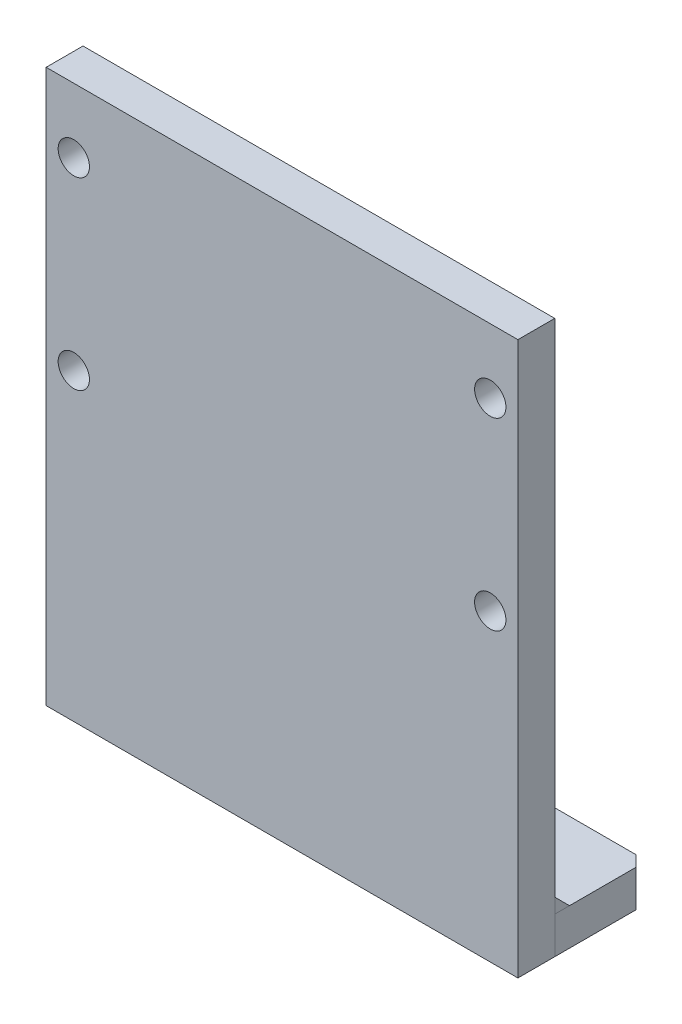
from build123d import *

# Parameters (mm, degrees)
SKETCH1_W           = 128
SKETCH1_H           = 150
SKETCH1_R           = 4.25
BOSS_EXTRUDE1_DEPTH = 5
SKETCH2_W           = 128
SKETCH2_H           = 25
SKETCH2_R           = 4.25
BOSS_EXTRUDE2_DEPTH = 10
FILLET_START        = -64
FILLET_BEAD1_DEPTH  = 128
CHAMFER1_SIZE       = 3


# Read off the part's stored shape, not the designer's step: Fillet Bead1
with BuildPart() as part:
    # Sketch1 → Boss-Extrude1 (new, symmetric)
    with BuildSketch(Plane.XY):
        Rectangle(SKETCH1_W, SKETCH1_H)
        with Locations((-56.5, 57.5)):
            Circle(SKETCH1_R, mode=Mode.SUBTRACT)
        with Locations((-56.5, 7.5)):
            Circle(SKETCH1_R, mode=Mode.SUBTRACT)
        with Locations(Location((56.5, 7.5, 0), (0, 0, 180))):
            Circle(SKETCH1_R, mode=Mode.SUBTRACT)
        with Locations(Location((56.5, 57.5, 0), (0, 0, 180))):
            Circle(SKETCH1_R, mode=Mode.SUBTRACT)
    extrude(amount=BOSS_EXTRUDE1_DEPTH, both=True)


with BuildPart() as body_2:
    # Sketch2 → Boss-Extrude2 (new body)
    with BuildSketch(Plane.XZ.offset(75)):
        with Locations((0, -17.5)):
            Rectangle(SKETCH2_W, SKETCH2_H)
        with Locations((-40, -20)):
            Circle(SKETCH2_R, mode=Mode.SUBTRACT)
        with Locations(Location((40, -20, 0), (0, 0, 180))):
            Circle(SKETCH2_R, mode=Mode.SUBTRACT)
    extrude(amount=-BOSS_EXTRUDE2_DEPTH)

    # Chamfer1
    chamfer1_edges = [body_2.edges().sort_by_distance(p)[0] for p in [
        (64, -70, -30),
        (-64, -70, -30),
    ]]
    chamfer(chamfer1_edges, length=CHAMFER1_SIZE)


with BuildPart() as body_3:
    # Fillet Bead1 outline → Fillet Bead1 (new body)
    with BuildSketch(Plane.YZ.offset(FILLET_START)):
        Polygon((-65, -9), (-61, -5), (-65, -5), align=None)
    extrude(amount=FILLET_BEAD1_DEPTH)


solid = Compound([part.part, body_2.part, body_3.part])
